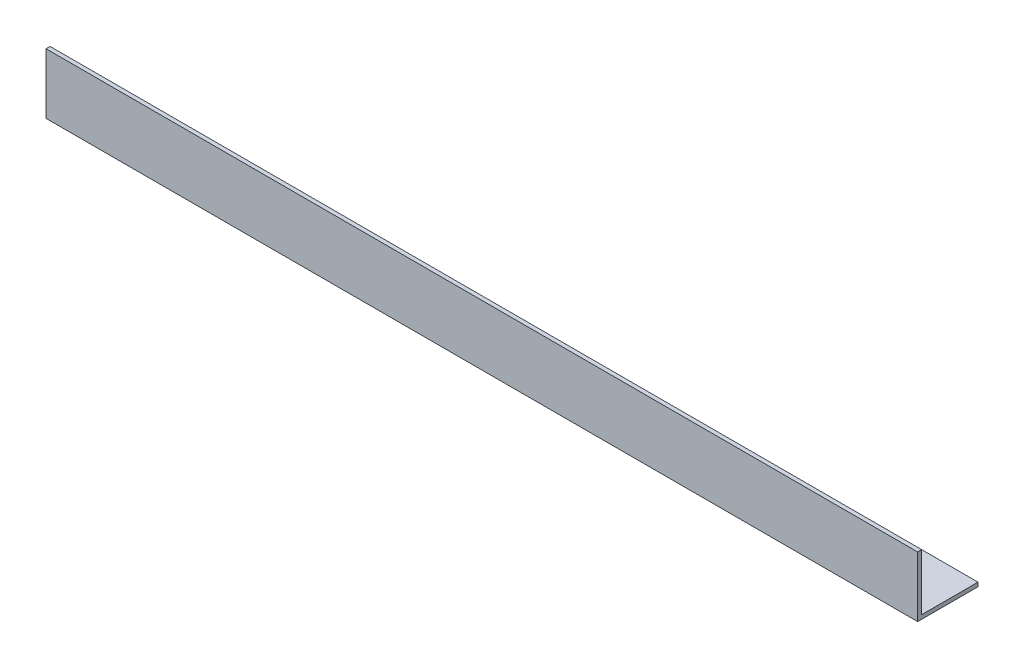
from build123d import *

# Parameters (mm, degrees)
EXTRUDE_1_DEPTH = 650


with BuildPart() as part:
    # Эскиз1 → Вытянуть-Тонкостенный1 (new body)
    with BuildSketch(Plane(origin=(0, 0, 0), x_dir=(0, 0, -1), z_dir=(1, 0, 0))):
        Polygon((45, 0), (0, 0), (0, 45), (3, 45), (3, 3), (45, 3), align=None)
    extrude(amount=EXTRUDE_1_DEPTH)


solid = part.part
